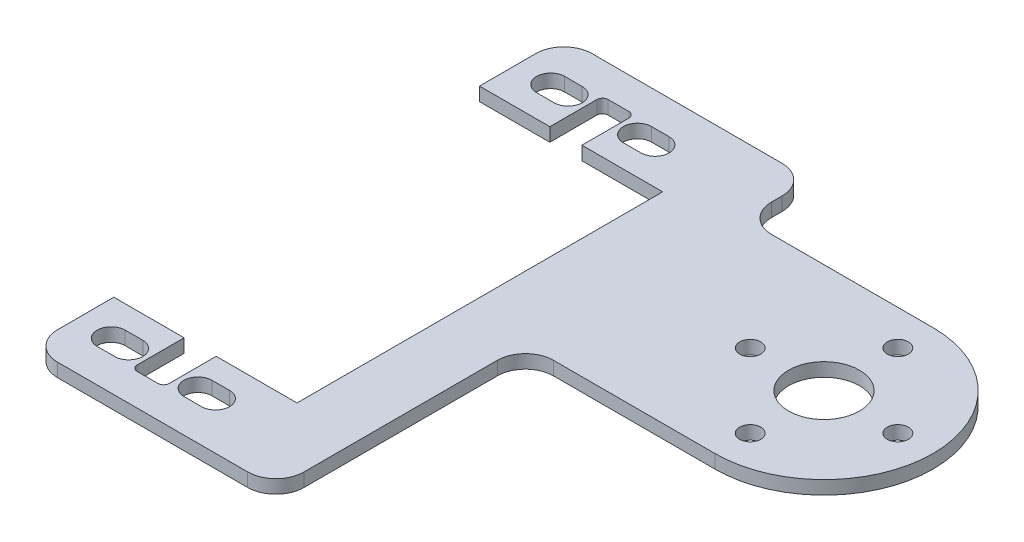
from build123d import *

# Parameters (mm, degrees)
SKETCH1_R          = 4.0005
SKETCH1_R_2        = 1.1938
BASE_FLANGE1_DEPTH = 1.524
SKETCH3_W          = 20.6756
SKETCH3_H          = 41.275
EXTRUDE1_DEPTH     = 1.524
SKETCH4_W          = 3.6195
SKETCH4_H          = 5.9436
EXTRUDE2_DEPTH     = 1.524
FILLET1_R          = 3.175
FILLET2_RADIUS     = 12.3063
FILLET2_LENGTH     = 1.524
FILLET3_R          = 0.635


# Sheet-metal steps are written as plain solids
with BuildPart() as part:
    # Sketch1 → Base-Flange1 (new body)
    with BuildSketch(Plane(origin=(0, 0, 0), x_dir=(1, 0, 0), z_dir=(0, 1, 0))):
        Polygon((12.3063, 12.3063), (12.3063, -12.3063), (-21.3995, -12.3063), (-21.3995, -40.4749), (-49.2125, -40.4749), (-49.2125, 19.8501), (-21.3995, 19.8501), (-21.3995, 12.3063), align=None)
        with Locations(Location((0, 0, 0), (0, 0, 90))):
            Circle(SKETCH1_R, mode=Mode.SUBTRACT)
        with Locations(Location((0, 8.3312, 0), (0, 0, 90))):
            Circle(SKETCH1_R_2, mode=Mode.SUBTRACT)
        with Locations(Location((8.3312, 0, 0), (0, 0, 90))):
            Circle(SKETCH1_R_2, mode=Mode.SUBTRACT)
        with Locations(Location((0, -8.3312, 0), (0, 0, 90))):
            Circle(SKETCH1_R_2, mode=Mode.SUBTRACT)
        with Locations(Location((-8.3312, 0, 0), (0, 0, 90))):
            Circle(SKETCH1_R_2, mode=Mode.SUBTRACT)
    extrude(amount=BASE_FLANGE1_DEPTH)

    # Sketch3 → Extrude1 (cut)
    with BuildSketch(Plane(origin=(0, 1.524, 0), x_dir=(1, 0, 0), z_dir=(0, 1, 0))):
        with Locations((-38.8747, -10.3124)):
            Rectangle(SKETCH3_W, SKETCH3_H)
    extrude(amount=-EXTRUDE1_DEPTH, mode=Mode.SUBTRACT)

    # Sketch4 → Extrude2 (cut)
    with BuildSketch(Plane(origin=(0, 1.524, 0), x_dir=(1, 0, 0), z_dir=(0, 1, 0))):
        with Locations((-39.46525, 13.2969)):
            Rectangle(SKETCH4_W, SKETCH4_H)
        with Locations((-39.46525, -33.9217)):
            Rectangle(SKETCH4_W, SKETCH4_H)
        with BuildLine():
            Line((-35.5473, 16.0782), (-33.5661, 16.0782))
            ThreePointArc((-33.5661, 16.0782), (-31.9786, 14.4907), (-33.5661, 12.9032))
            Line((-33.5661, 12.9032), (-35.5473, 12.9032))
            ThreePointArc((-35.5473, 12.9032), (-37.1348, 14.4907), (-35.5473, 16.0782))
        make_face()
        with BuildLine():
            Line((-45.3517, 16.0782), (-43.3705, 16.0782))
            ThreePointArc((-43.3705, 16.0782), (-41.783, 14.4907), (-43.3705, 12.9032))
            Line((-43.3705, 12.9032), (-45.3517, 12.9032))
            ThreePointArc((-45.3517, 12.9032), (-46.9392, 14.4907), (-45.3517, 16.0782))
        make_face()
        with BuildLine():
            Line((-35.5473, -33.528), (-33.5661, -33.528))
            ThreePointArc((-33.5661, -33.528), (-31.9786, -35.1155), (-33.5661, -36.703))
            Line((-33.5661, -36.703), (-35.5473, -36.703))
            ThreePointArc((-35.5473, -36.703), (-37.1348, -35.1155), (-35.5473, -33.528))
        make_face()
        with BuildLine():
            Line((-45.3517, -33.528), (-43.3705, -33.528))
            ThreePointArc((-43.3705, -33.528), (-41.783, -35.1155), (-43.3705, -36.703))
            Line((-43.3705, -36.703), (-45.3517, -36.703))
            ThreePointArc((-45.3517, -36.703), (-46.9392, -35.1155), (-45.3517, -33.528))
        make_face()
    extrude(amount=-EXTRUDE2_DEPTH, mode=Mode.SUBTRACT)

    # Fillet1
    fillet1_edges = [part.edges().sort_by_distance(p)[0] for p in [
        (-21.3995, 0.762, 12.3063),
        (-21.3995, 0.762, 40.4749),
        (-49.2125, 0.762, 40.4749),
        (-49.2125, 0.762, -19.8501),
        (-21.3995, 0.762, -19.8501),
        (-21.3995, 0.762, -12.3063),
    ]]
    fillet(fillet1_edges, radius=FILLET1_R)

    # Fillet2: full round fillet: the end face becomes a half cylinder, R = half its width
    fillet2_face = Plane((12.3063, 0.762, 0), x_dir=(0, 1, 0), z_dir=(1, 0, 0))  # on the end face: x along it, z out of the body
    fillet2_slab = fillet2_face.offset(-FILLET2_RADIUS / 2) * Box(FILLET2_LENGTH, 2 * FILLET2_RADIUS, FILLET2_RADIUS, mode=Mode.PRIVATE)  # the body's end, R deep
    fillet2_round = Plane((0, 0.762, 0), x_dir=(1, 0, 0), z_dir=(0, 1, 0)) * Cylinder(FILLET2_RADIUS, FILLET2_LENGTH, mode=Mode.PRIVATE)  # its axis R under the face
    add(fillet2_slab - fillet2_round, mode=Mode.SUBTRACT)

    # Fillet3
    fillet3_edges = [part.edges().sort_by_distance(p)[0] for p in [
        (-41.275, 0.762, -16.2687),
        (-37.6555, 0.762, -16.2687),
        (-41.275, 0.762, 36.8935),
        (-37.6555, 0.762, 36.8935),
    ]]
    fillet(fillet3_edges, radius=FILLET3_R)


solid = part.part
